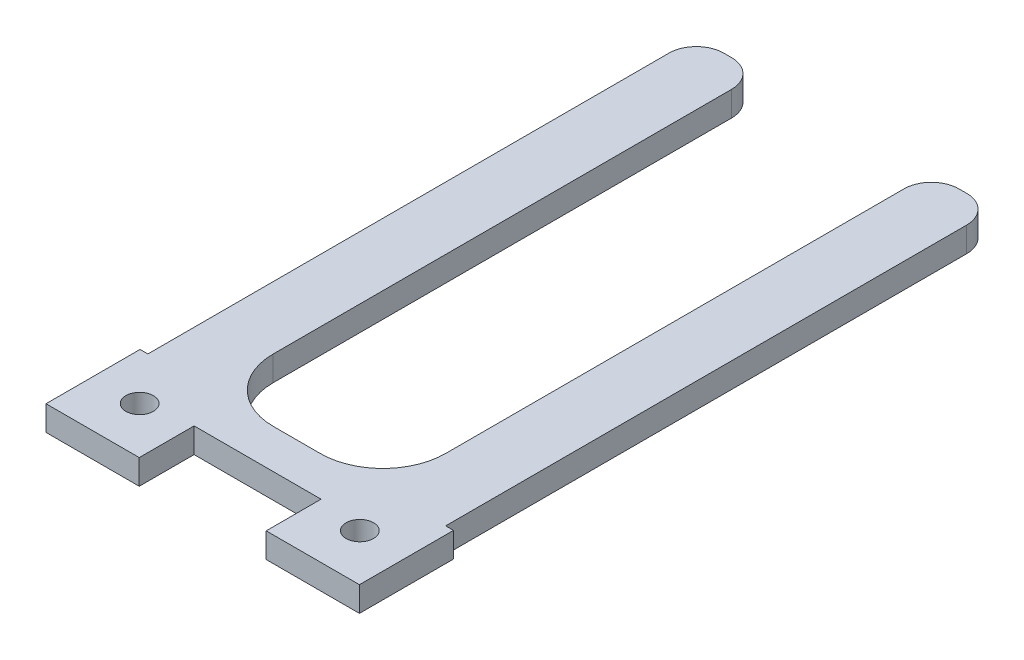
from build123d import *

# Parameters (mm, degrees)
CROQUIS1_R              = 1.75
SALIENTE_EXTRUIR1_DEPTH = 1.5875
REDONDEO1_R             = 8


with BuildPart() as part:
    # Croquis1 → Saliente-Extruir1 (new, symmetric)
    with BuildSketch(Plane(origin=(0, 0, 0), x_dir=(1, 0, 0), z_dir=(0, 1, 0))):
        with BuildLine():
            Line((8.1, 0), (8.1, -7))
            Line((8.1, -7), (20, -7))
            Line((20, -7), (20, 5))
            Line((20, 5), (19, 5))
            Line((19, 5), (19, 71.5))
            ThreePointArc((19, 71.5), (17.974873734, 73.974873734), (15.5, 75))
            Line((15.5, 75), (14.5, 75))
            ThreePointArc((14.5, 75), (12.025126266, 73.974873734), (11, 71.5))
            Line((11, 71.5), (11, 5))
            Line((11, 5), (-11, 5))
            Line((-11, 5), (-11, 71.5))
            ThreePointArc((-11, 71.5), (-12.025126266, 73.974873734), (-14.5, 75))
            Line((-14.5, 75), (-15.5, 75))
            ThreePointArc((-15.5, 75), (-17.974873734, 73.974873734), (-19, 71.5))
            Line((-19, 71.5), (-19, 5))
            Line((-19, 5), (-20, 5))
            Line((-20, 5), (-20, -7))
            Line((-20, -7), (-8.1, -7))
            Line((-8.1, -7), (-8.1, 0))
            Line((-8.1, 0), (8.1, 0))
        make_face()
        with Locations((14.05, -1)):
            Circle(CROQUIS1_R, mode=Mode.SUBTRACT)
        with Locations((-14.05, -1)):
            Circle(CROQUIS1_R, mode=Mode.SUBTRACT)
    extrude(amount=SALIENTE_EXTRUIR1_DEPTH, both=True)

    # Redondeo1
    redondeo1_edges = [part.edges().sort_by_distance(p)[0] for p in [
        (11, 0, -5),
        (-11, 0, -5),
    ]]
    fillet(redondeo1_edges, radius=REDONDEO1_R)


solid = part.part
